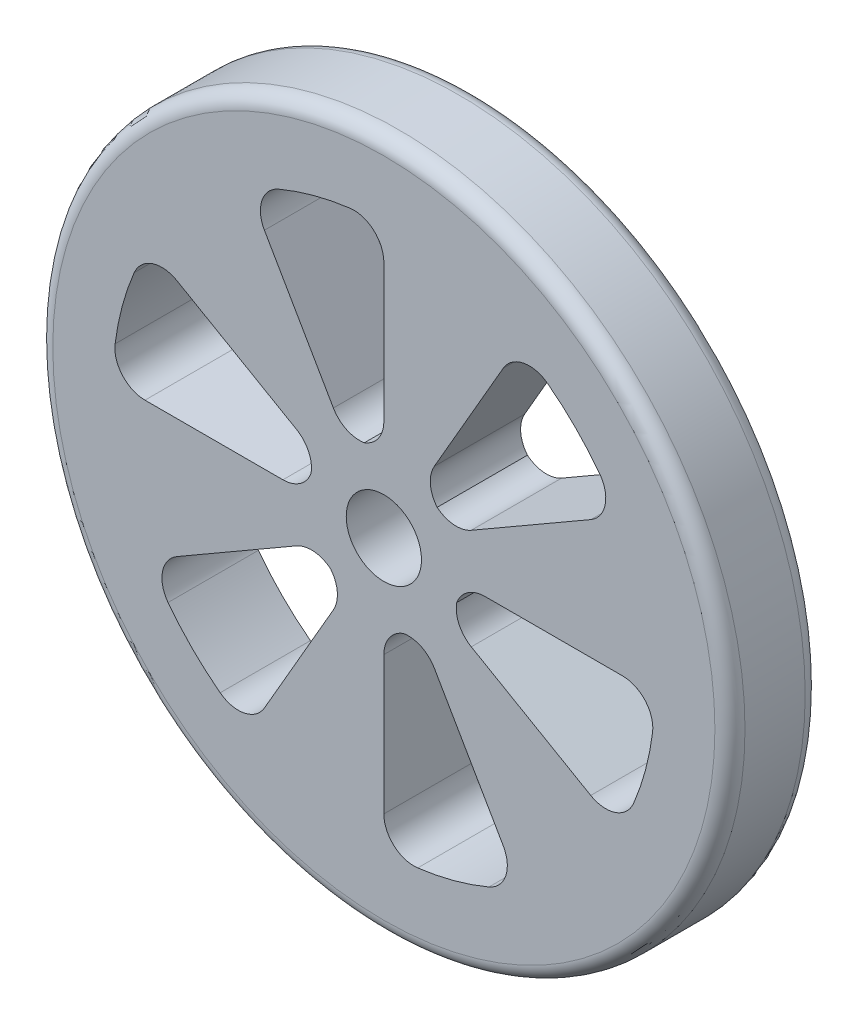
from build123d import *

# Parameters (mm, degrees)
SKETCH1_R           = 23
BOSS_EXTRUDE1_DEPTH = 6
FILLET1_R           = 1
CUT_EXTRUDE1_DEPTH  = 34.075670817082454
SKETCH3_R           = 2.5
CUT_EXTRUDE2_DEPTH  = 8
FILLET2_R           = 2


with BuildPart() as part:
    # Sketch1 → Boss-Extrude1 (new body)
    with BuildSketch(Plane.XY):
        Circle(SKETCH1_R)
    extrude(amount=BOSS_EXTRUDE1_DEPTH)

    # Fillet1
    fillet1_edges = [part.edges().sort_by_distance(p)[0] for p in [
        (-23, 2.82e-15, 0),
        (-23, 2.82e-15, 6),
    ]]
    fillet(fillet1_edges, radius=FILLET1_R)

    # Sketch2 → Cut-Extrude1 (cut, through all)
    with BuildSketch(Plane(origin=(0, 0, 0), x_dir=(-1, 0, 0), z_dir=(0, 0, -1))):
        with BuildLine():
            Line((0, 18), (0, 4.999999999999997))
            ThreePointArc((0, 4.999999999999997), (1.2940952255126064, 4.829629131445338), (2.500000000000004, 4.330127018922188))
            Line((2.500000000000004, 4.330127018922188), (9.000000000000016, 15.588457268119884))
            ThreePointArc((9.000000000000016, 15.588457268119884), (4.658742811845384, 17.386664873203223), (0, 18))
        make_face()
        with BuildLine():
            Line((15.588457268119916, 8.999999999999963), (4.330127018922196, 2.499999999999989))
            ThreePointArc((4.330127018922196, 2.499999999999989), (4.829629131445343, 1.294095225512589), (4.999999999999997, -1.746e-14))
            Line((4.999999999999997, -1.746e-14), (18, -6.285e-14))
            ThreePointArc((18, -6.285e-14), (17.386664873203244, 4.658742811845323), (15.588457268119916, 8.999999999999963))
        make_face()
        with BuildLine():
            Line((15.588457268119898, -8.999999999999995), (4.330127018922192, -2.4999999999999973))
            ThreePointArc((4.330127018922192, -2.4999999999999973), (3.5355339059327373, -3.5355339059327355), (2.500000000000001, -4.330127018922191))
            Line((2.500000000000001, -4.330127018922191), (9.000000000000007, -15.588457268119889))
            ThreePointArc((9.000000000000007, -15.588457268119889), (12.72792206135786, -12.727922061357848), (15.588457268119898, -8.999999999999995))
        make_face()
        with BuildLine():
            Line((3.97e-15, -18), (9.6e-16, -4.999999999999997))
            ThreePointArc((9.6e-16, -4.999999999999997), (-1.2940952255126013, -4.82962913144534), (-2.499999999999997, -4.330127018922192))
            Line((-2.499999999999997, -4.330127018922192), (-8.999999999999993, -15.588457268119898))
            ThreePointArc((-8.999999999999993, -15.588457268119898), (-4.658742811845367, -17.38666487320323), (3.97e-15, -18))
        make_face()
        with BuildLine():
            Line((-15.588457268119889, -9.000000000000009), (-4.330127018922191, -2.5000000000000013))
            ThreePointArc((-4.330127018922191, -2.5000000000000013), (-4.829629131445345, -1.2940952255125773), (-4.9999999999999964, 5.237e-14))
            Line((-4.9999999999999964, 5.237e-14), (-18, 5.83e-15))
            ThreePointArc((-18, 5.83e-15), (-17.38666487320323, -4.658742811845374), (-15.588457268119889, -9.000000000000009))
        make_face()
        with BuildLine():
            Line((-15.58845726811979, 9.000000000000181), (-4.330127018922163, 2.500000000000049))
            ThreePointArc((-4.330127018922163, 2.500000000000049), (-3.5355339059326933, 3.5355339059327786), (-2.499999999999943, 4.330127018922223))
            Line((-2.499999999999943, 4.330127018922223), (-8.9999999999998, 15.588457268120008))
            ThreePointArc((-8.9999999999998, 15.588457268120008), (-12.7279220613577, 12.727922061358008), (-15.58845726811979, 9.000000000000181))
        make_face()
    extrude(amount=-CUT_EXTRUDE1_DEPTH, mode=Mode.SUBTRACT)

    # Sketch3 → Cut-Extrude2 (cut)
    with BuildSketch(Plane(origin=(0, 0, 0), x_dir=(-1, 0, 0), z_dir=(0, 0, -1))):
        Circle(SKETCH3_R)
    extrude(amount=-CUT_EXTRUDE2_DEPTH, mode=Mode.SUBTRACT)

    # Fillet2
    # the kernel refuses this fillet: 2 mm, written as the material it adds along each edge
    with BuildSketch(Plane(origin=(8.9999999999998, 15.58845726812001, 0), x_dir=(0.8330141641507608, -0.5532516627396699, 0), z_dir=(0, 0, 1))) as fillet2_piece_1:
        with BuildLine():
            CenterArc((2.1291790264677095, -1.996074518473306), FILLET2_R, 86.40962210927087, 97.18075578145812)
            Line((0.13310450799440263, -2.121320343559637), (0, 0))
            ThreePointArc((0, 0), (1.127212425777022, 0.03532933374024082), (2.2544248515540453, -1.2e-16))
        make_face()
    extrude(amount=6)
    with BuildSketch(Plane(origin=(15.58845726811979, 9.000000000000181, 0), x_dir=(-0.5532516627396912, 0.8330141641507466, 0), z_dir=(0, 0, 1))) as fillet2_piece_2:
        with BuildLine():
            CenterArc((2.1291790264677095, 1.9960745184733064), FILLET2_R, 176.40962210927088, 97.18075578145823)
            Line((0.13310450799440354, 2.1213203435596415), (0, 0))
            ThreePointArc((0, 0), (1.127212425777022, -0.03532933374024257), (2.2544248515540453, 9e-17))
        make_face()
    extrude(amount=6)
    with BuildSketch(Plane(origin=(2.499999999999943, 4.330127018922223, 0), x_dir=(0.4999999999999891, 0.8660254037844449, 0), z_dir=(0, 0, 1))) as fillet2_piece_3:
        with BuildLine():
            CenterArc((1.7082039324998066, -1.9999999999999998), FILLET2_R, 90.00000000000001, 73.39845040098082)
            ThreePointArc((-0.2084257625000237, -1.4285714285714644), (-0.05238081560950268, -0.7218479107478997), (0, 0))
            Line((0, 0), (1.7082039324998062, 0))
        make_face()
    extrude(amount=6)
    with BuildSketch(Plane(origin=(4.330127018922163, 2.5000000000000484, 0), x_dir=(0.8660254037844327, 0.5000000000000103, 0), z_dir=(0, 0, 1))) as fillet2_piece_4:
        with BuildLine():
            CenterArc((1.708203932499807, 2), FILLET2_R, 196.6015495990192, 73.39845040098078)
            ThreePointArc((-0.20842576250002318, 1.428571428571463), (-0.05238081560950245, 0.7218479107478992), (0, 0))
            Line((0, 0), (1.7082039324998068, -6e-17))
        make_face()
    extrude(amount=6)
    with BuildSketch(Plane(origin=(15.588457268119889, -9.000000000000009, 0), x_dir=(-0.8660254037844383, 0.5000000000000009, 0), z_dir=(0, 0, 1))) as fillet2_piece_5:
        with BuildLine():
            CenterArc((2.1254921336124535, -2), FILLET2_R, 89.99999999999999, 97.18075578145834)
            ThreePointArc((0.14117865031401003, -2.250000000000001), (0.03532933374023933, -1.1272124257770224), (0, 0))
            Line((0, 0), (2.125492133612454, -1.1e-16))
        make_face()
    extrude(amount=6)
    with BuildSketch(Plane(origin=(18, 5.83e-15, 0), x_dir=(-1, 3.63e-15, 0), z_dir=(0, 0, 1))) as fillet2_piece_6:
        with BuildLine():
            CenterArc((2.1254921336124433, 2), FILLET2_R, 172.81924421854202, 97.18075578145795)
            ThreePointArc((0.14117865031399895, 2.2499999999999902), (0.03532933374023574, 1.1272124257770182), (0, 0))
            Line((0, 0), (2.1254921336124433, 0))
        make_face()
    extrude(amount=6)
    with BuildSketch(Plane(origin=(4.330127018922191, -2.5000000000000018, 0), x_dir=(0.36973419276377445, 0.9291375714614709, 0), z_dir=(0, 0, 1))) as fillet2_piece_7:
        with BuildLine():
            CenterArc((1.7324349857948858, -1.9790476737562004), FILLET2_R, 98.30077479950961, 73.39845040099217)
            Line((-0.2466126879613723, -1.690308509457446), (0, 0))
            ThreePointArc((0, 0), (0.7218479107478688, -0.05238081560949556), (1.4436958214957383, 0))
        make_face()
    extrude(amount=6)
    with BuildSketch(Plane(origin=(4.9999999999999964, 5.25e-14, 0), x_dir=(-0.14436958214956583, -0.9895238368781015, 0), z_dir=(0, 0, 1))) as fillet2_piece_8:
        with BuildLine():
            CenterArc((1.7324349857949062, 1.9790476737562006), FILLET2_R, 188.3007747994978, 73.39845040099254)
            Line((-0.246612687961354, 1.6903085094574617), (0, 0))
            ThreePointArc((0, 0), (0.7218479107478792, 0.05238081560949936), (1.4436958214957574, 0))
        make_face()
    extrude(amount=6)
    with BuildSketch(Plane(origin=(-3.43e-15, -18, 0), x_dir=(0.9980372592366533, 0.06262291254316825, 0), z_dir=(0, 0, 1))) as fillet2_piece_9:
        with BuildLine():
            CenterArc((2.129179026467711, 1.996074518473307), FILLET2_R, 176.4096221092709, 97.18075578145829)
            Line((0.13310450799440432, 2.121320343559642), (0, 0))
            ThreePointArc((0, 0), (1.1272124257770224, -0.03532933374023745), (2.254424851554048, 3e-17))
        make_face()
    extrude(amount=6)
    with BuildSketch(Plane(origin=(8.999999999999993, -15.588457268119898, 0), x_dir=(-0.8956370766939215, -0.44478559649697147, 0), z_dir=(0, 0, 1))) as fillet2_piece_10:
        with BuildLine():
            CenterArc((2.129179026467713, -1.9960745184733077), FILLET2_R, 86.40962210927084, 97.1807557814584)
            Line((0.1331045079944061, -2.121320343559647), (0, 0))
            ThreePointArc((0, 0), (1.1272124257770244, 0.03532933374023982), (2.2544248515540497, 8e-17))
        make_face()
    extrude(amount=6)
    with BuildSketch(Plane(origin=(2.4999999999999973, -4.330127018922191, 0), x_dir=(0.4999999999999994, -0.8660254037844389, 0), z_dir=(0, 0, 1))) as fillet2_piece_11:
        with BuildLine():
            CenterArc((1.7082039324998068, -1.9999999999999998), FILLET2_R, 90.00000000000001, 73.39845040098074)
            ThreePointArc((-0.20842576250002273, -1.428571428571461), (-0.05238081560950084, -0.7218479107478981), (0, 0))
            Line((0, 0), (1.7082039324998066, 2e-17))
        make_face()
    extrude(amount=6)
    with BuildSketch(Plane(origin=(-9.6e-16, -4.9999999999999964, 0), x_dir=(-2.2e-16, -1, 0), z_dir=(0, 0, 1))) as fillet2_piece_12:
        with BuildLine():
            CenterArc((1.7082039324998068, 2), FILLET2_R, 196.6015495990192, 73.39845040098078)
            ThreePointArc((-0.2084257625000235, 1.4285714285714635), (-0.0523808156095013, 0.7218479107478993), (0, 0))
            Line((0, 0), (1.7082039324998064, 0))
        make_face()
    extrude(amount=6)
    with BuildSketch(Plane(origin=(-9.000000000000007, -15.588457268119889, 0), x_dir=(-0.8330141641507522, 0.5532516627396828, 0), z_dir=(0, 0, 1))) as fillet2_piece_13:
        with BuildLine():
            CenterArc((2.1291790264677144, -1.9960745184733075), FILLET2_R, 86.40962210927094, 97.18075578145817)
            Line((0.13310450799440787, -2.121320343559643), (0, 0))
            ThreePointArc((0, 0), (1.1272124257770235, 0.03532933374024261), (2.2544248515540475, 4e-17))
        make_face()
    extrude(amount=6)
    with BuildSketch(Plane(origin=(-2.500000000000001, -4.330127018922191, 0), x_dir=(-0.5000000000000007, -0.8660254037844384, 0), z_dir=(0, 0, 1))) as fillet2_piece_14:
        with BuildLine():
            CenterArc((1.7082039324998013, -2), FILLET2_R, 90.00000000000001, 73.39845040098085)
            ThreePointArc((-0.20842576250002953, -1.428571428571465), (-0.05238081560950266, -0.7218479107479008), (0, 0))
            Line((0, 0), (1.7082039324998008, -1e-17))
        make_face()
    extrude(amount=6)
    with BuildSketch(Plane(origin=(-4.330127018922191, -2.4999999999999973, 0), x_dir=(-0.8660254037844389, -0.4999999999999994, 0), z_dir=(0, 0, 1))) as fillet2_piece_15:
        with BuildLine():
            CenterArc((1.7082039324998053, 2), FILLET2_R, 196.60154959901914, 73.39845040098089)
            ThreePointArc((-0.20842576250002512, 1.428571428571465), (-0.05238081560950129, 0.7218479107479002), (0, 0))
            Line((0, 0), (1.7082039324998066, -2e-17))
        make_face()
    extrude(amount=6)
    with BuildSketch(Plane(origin=(-15.588457268119896, -8.999999999999996, 0), x_dir=(0.5532516627396812, -0.8330141641507532, 0), z_dir=(0, 0, 1))) as fillet2_piece_16:
        with BuildLine():
            CenterArc((2.129179026467709, 1.996074518473306), FILLET2_R, 176.4096221092708, 97.18075578145829)
            Line((0.1331045079944023, 2.1213203435596437), (0, 0))
            ThreePointArc((0, 0), (1.127212425777022, -0.03532933374023939), (2.2544248515540444, -1.1e-16))
        make_face()
    extrude(amount=6)
    with BuildSketch(Plane(origin=(-4.999999999999998, -1.714e-14, 0), x_dir=(-1, -3.62e-15, 0), z_dir=(0, 0, 1))) as fillet2_piece_17:
        with BuildLine():
            CenterArc((1.7082039324997937, -2), FILLET2_R, 90, 73.39845040098072)
            ThreePointArc((-0.20842576250003547, -1.4285714285714597), (-0.05238081560950375, -0.7218479107478981), (0, 0))
            Line((0, 0), (1.708203932499794, 0))
        make_face()
    extrude(amount=6)
    with BuildSketch(Plane(origin=(-4.330127018922196, 2.499999999999989, 0), x_dir=(-0.8660254037844398, 0.49999999999999784, 0), z_dir=(0, 0, 1))) as fillet2_piece_18:
        with BuildLine():
            CenterArc((1.7082039324998106, 2), FILLET2_R, 196.60154959901917, 73.39845040098083)
            ThreePointArc((-0.20842576250002, 1.4285714285714646), (-0.05238081560950151, 0.7218479107478999), (0, 0))
            Line((0, 0), (1.708203932499811, -2e-17))
        make_face()
    extrude(amount=6)
    with BuildSketch(Plane(origin=(-18, -6.285e-14, 0), x_dir=(0.06262291254316511, 0.9980372592366534, 0), z_dir=(0, 0, 1))) as fillet2_piece_19:
        with BuildLine():
            CenterArc((2.129179026467712, -1.996074518473306), FILLET2_R, 86.4096221092709, 97.18075578145834)
            Line((0.13310450799440612, -2.121320343559647), (0, 0))
            ThreePointArc((0, 0), (1.1272124257770233, 0.0353293337402411), (2.254424851554047, 0))
        make_face()
    extrude(amount=6)
    with BuildSketch(Plane(origin=(-15.588457268119917, 8.999999999999963, 0), x_dir=(-0.4447855964969697, -0.8956370766939222, 0), z_dir=(0, 0, 1))) as fillet2_piece_20:
        with BuildLine():
            CenterArc((2.1291790264677113, 1.9960745184733066), FILLET2_R, 176.40962210927077, 97.18075578145834)
            Line((0.13310450799440465, 2.1213203435596455), (0, 0))
            ThreePointArc((0, 0), (1.1272124257770235, -0.03532933374024044), (2.254424851554046, -6e-17))
        make_face()
    extrude(amount=6)
    with BuildSketch(Plane(origin=(-2.2e-16, 18, 0), x_dir=(-0.9980372592366533, -0.06262291254316824, 0), z_dir=(0, 0, 1))) as fillet2_piece_21:
        with BuildLine():
            CenterArc((2.1291790264677126, 1.996074518473307), FILLET2_R, 176.40962210927086, 97.18075578145829)
            Line((0.13310450799440565, 2.1213203435596437), (0, 0))
            ThreePointArc((0, 0), (1.1272124257770244, -0.03532933374024468), (2.254424851554049, 0))
        make_face()
    extrude(amount=6)
    with BuildSketch(Plane(origin=(-9.000000000000018, 15.588457268119885, 0), x_dir=(0.5000000000000014, -0.8660254037844377, 0), z_dir=(0, 0, 1))) as fillet2_piece_22:
        with BuildLine():
            CenterArc((2.125492133612456, 2), FILLET2_R, 172.81924421854168, 97.18075578145829)
            ThreePointArc((0.1411786503140125, 2.2500000000000018), (0.03532933374024108, 1.1272124257770235), (0, 0))
            Line((0, 0), (2.1254921336124544, 1.2e-16))
        make_face()
    extrude(amount=6)
    with BuildSketch(Plane(origin=(0, 4.9999999999999964, 0), x_dir=(-0.9895238368781003, -0.14436958214957385, 0), z_dir=(0, 0, 1))) as fillet2_piece_23:
        with BuildLine():
            CenterArc((1.732434985794886, -1.9790476737562013), FILLET2_R, 98.30077479950961, 73.39845040099226)
            Line((-0.24661268796137278, -1.6903085094574508), (0, 0))
            ThreePointArc((0, 0), (0.7218479107478691, -0.05238081560949842), (1.4436958214957385, -2e-17))
        make_face()
    extrude(amount=6)
    with BuildSketch(Plane(origin=(-2.500000000000004, 4.330127018922187, 0), x_dir=(-0.5000000000000007, 0.8660254037844383, 0), z_dir=(0, 0, 1))) as fillet2_piece_24:
        with BuildLine():
            CenterArc((1.7082039324998055, -2), FILLET2_R, 90.00000000000001, 73.39845040098085)
            ThreePointArc((-0.20842576250002545, -1.4285714285714655), (-0.05238081560950322, -0.7218479107479004), (0, 0))
            Line((0, 0), (1.708203932499805, 1e-17))
        make_face()
    extrude(amount=6)


solid = part.part
